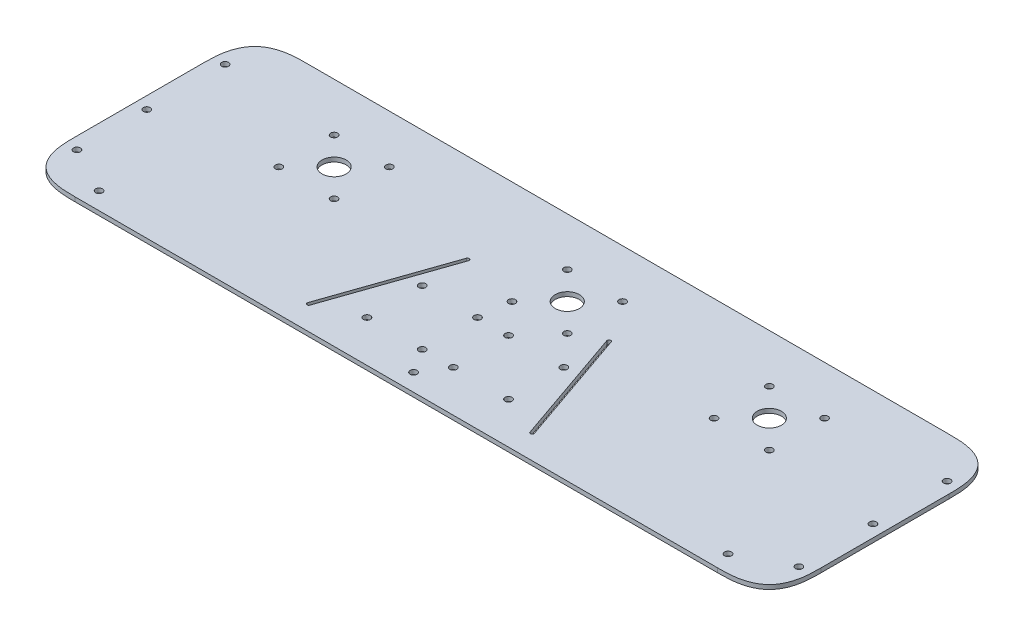
from build123d import *

# Parameters (mm, degrees)
SKETCH1_W           = 432
SKETCH1_H           = 200
BOSS_EXTRUDE1_DEPTH = 2.5
SKETCH3_R           = 7
SKETCH3_R_2         = 2
SKETCH3_W           = 498.20945101
SKETCH3_H           = 57.36356312
CUT_EXTRUDE1_DEPTH  = 2.5
SKETCH5_W           = 366.875294571
SKETCH5_H           = 10
SKETCH5_W_2         = 65.124705429
CUT_EXTRUDE3_DEPTH  = 2.5
SKETCH6_R           = 2
CUT_EXTRUDE4_DEPTH  = 2.5
CUT_EXTRUDE5_DEPTH  = 2.5
FILLET1_SIZE        = 30
SKETCH9_R           = 2
CUT_EXTRUDE6_DEPTH  = 2.5
SKETCH10_R          = 2
CUT_EXTRUDE7_DEPTH  = 2.5
SKETCH11_R          = 7
SKETCH11_R_2        = 2
CUT_EXTRUDE8_DEPTH  = 10


with BuildPart() as part:
    # Sketch1 → Boss-Extrude1 (new body)
    with BuildSketch(Plane(origin=(0, 0, 0), x_dir=(1, 0, 0), z_dir=(0, 1, 0))):
        with Locations((112.865968756, 71.914913526)):
            Rectangle(SKETCH1_W, SKETCH1_H)
    extrude(amount=BOSS_EXTRUDE1_DEPTH)

    # Sketch3 → Cut-Extrude1 (cut)
    with BuildSketch(Plane(origin=(0, 2.5, 0), x_dir=(1, 0, 0), z_dir=(0, 1, 0))):
        with Locations(Location((-13.134031244, 71.914913526, 0), (0, 0, 270))):
            Circle(SKETCH3_R)
        with Locations(Location((-29.135857702, 55.913087067, 0), (0, 0, 270))):
            Circle(SKETCH3_R_2)
        with Locations(Location((-29.135857702, 87.916739984, 0), (0, 0, 270))):
            Circle(SKETCH3_R_2)
        with Locations(Location((2.867795214, 55.913087067, 0), (0, 0, 270))):
            Circle(SKETCH3_R_2)
        with Locations(Location((2.867795214, 87.916739984, 0), (0, 0, 270))):
            Circle(SKETCH3_R_2)
        with Locations(Location((238.865968756, 71.914913526, 0), (0, 0, 270))):
            Circle(SKETCH3_R)
        with Locations((79.761243251, 144.596695086)):
            Rectangle(SKETCH3_W, SKETCH3_H)
        with Locations(Location((222.864142298, 55.913087067, 0), (0, 0, 270))):
            Circle(SKETCH3_R_2)
        with Locations(Location((254.867795214, 87.916739984, 0), (0, 0, 270))):
            Circle(SKETCH3_R_2)
        with Locations(Location((222.864142298, 87.916739984, 0), (0, 0, 270))):
            Circle(SKETCH3_R_2)
        with Locations(Location((254.867795214, 55.913087067, 0), (0, 0, 270))):
            Circle(SKETCH3_R_2)
    extrude(amount=-CUT_EXTRUDE1_DEPTH, mode=Mode.SUBTRACT)

    # Sketch5 → Cut-Extrude3 (cut)
    with BuildSketch(Plane(origin=(0, 2.5, 0), x_dir=(1, 0, 0), z_dir=(0, 1, 0))):
        with Locations((80.303616041, -23.085086474)):
            Rectangle(SKETCH5_W, SKETCH5_H)
        with Locations((296.303616042, -23.085086474)):
            Rectangle(SKETCH5_W_2, SKETCH5_H)
    extrude(amount=-CUT_EXTRUDE3_DEPTH, mode=Mode.SUBTRACT)

    # Sketch6 → Cut-Extrude4 (cut)
    with BuildSketch(Plane(origin=(0, 2.5, 0), x_dir=(1, 0, 0), z_dir=(0, 1, 0))):
        with Locations(Location((71.864142298, 5.913087067, 0), (0, 0, 270))):
            Circle(SKETCH6_R)
        with Locations(Location((71.864142298, 37.916739984, 0), (0, 0, 270))):
            Circle(SKETCH6_R)
        with Locations(Location((103.867795214, 37.916739984, 0), (0, 0, 270))):
            Circle(SKETCH6_R)
        with Locations(Location((103.867795214, 5.913087067, 0), (0, 0, 270))):
            Circle(SKETCH6_R)
        with Locations(Location((121.864142298, 5.913087067, 0), (0, 0, 270))):
            Circle(SKETCH6_R)
        with Locations(Location((121.864142298, 37.916739984, 0), (0, 0, 270))):
            Circle(SKETCH6_R)
        with Locations(Location((153.867795214, 37.916739984, 0), (0, 0, 270))):
            Circle(SKETCH6_R)
        with Locations(Location((153.867795214, 5.913087067, 0), (0, 0, 270))):
            Circle(SKETCH6_R)
    extrude(amount=-CUT_EXTRUDE4_DEPTH, mode=Mode.SUBTRACT)

    # Sketch8 → Cut-Extrude5 (cut)
    with BuildSketch(Plane(origin=(0, 2.5, 0), x_dir=(1, 0, 0), z_dir=(0, 1, 0))):
        with BuildLine():
            Line((176.582305496, -4.412929011), (152.923062834, 63.765083659))
            ThreePointArc((152.923062834, 63.765083659), (153.539952677, 65.037658577), (154.812527595, 64.420768733))
            Line((154.812527595, 64.420768733), (178.471770257, -3.757243937))
            ThreePointArc((178.471770257, -3.757243937), (177.854880414, -5.029818855), (176.582305496, -4.412929011))
        make_face()
        with BuildLine():
            Line((47.260167255, -3.757243937), (70.919409917, 64.420768733))
            ThreePointArc((70.919409917, 64.420768733), (72.191984835, 65.037658577), (72.808874679, 63.765083659))
            Line((72.808874679, 63.765083659), (49.149632016, -4.412929011))
            ThreePointArc((49.149632016, -4.412929011), (47.877057099, -5.029818855), (47.260167255, -3.757243937))
        make_face()
    extrude(amount=-CUT_EXTRUDE5_DEPTH, mode=Mode.SUBTRACT)

    # Fillet1
    # a fillet whose section is not a circle: 30 mm, written as the material it takes off along each edge
    with BuildSketch(Plane(origin=(-103.134031244, -75, -115.914913526), x_dir=(0, 0, 1), z_dir=(0, 1, 0)), Plane(origin=(-103.134031244, 77.5, 18.085086474), x_dir=(0, 0, -1), z_dir=(0, -1, 0)), Plane(origin=(328.865968756, 77.5, 18.085086474), x_dir=(-1, 0, 0), z_dir=(0, -1, 0))) as fillet1_piece_1:
        with BuildLine():
            add(Edge.make_bspline([(FILLET1_SIZE, 0), (FILLET1_SIZE * 0.831801948466, 0), (FILLET1_SIZE * 0.663603896932, 0), (FILLET1_SIZE * 0.292893218813, FILLET1_SIZE * 0.0716919198361), (FILLET1_SIZE * 0.0716919198361, FILLET1_SIZE * 0.292893218813), (0, FILLET1_SIZE * 0.663603896932), (0, FILLET1_SIZE * 0.831801948466), (0, FILLET1_SIZE)], knots=[0, 0, 0, 0, 0, 0, 0.5, 0.5, 1, 1, 1, 1, 1, 1], degree=5))
            Line((0, FILLET1_SIZE), (0, 0))
            Line((0, 0), (FILLET1_SIZE, 0))
        make_face()
    extrude(amount=152.5, mode=Mode.SUBTRACT)
    with BuildSketch(Plane(origin=(328.865968756, 77.5, -115.914913526), x_dir=(-1, 0, 0), z_dir=(0, -1, 0))) as fillet1_piece_2:
        with BuildLine():
            add(Edge.make_bspline([(FILLET1_SIZE, 0), (FILLET1_SIZE * 0.831801948466, 0), (FILLET1_SIZE * 0.663603896932, 0), (FILLET1_SIZE * 0.292893218813, -FILLET1_SIZE * 0.0716919198361), (FILLET1_SIZE * 0.0716919198361, -FILLET1_SIZE * 0.292893218813), (0, -FILLET1_SIZE * 0.663603896932), (0, -FILLET1_SIZE * 0.831801948466), (0, -FILLET1_SIZE)], knots=[0, 0, 0, 0, 0, 0, 0.5, 0.5, 1, 1, 1, 1, 1, 1], degree=5))
            Line((0, -FILLET1_SIZE), (0, 0))
            Line((0, 0), (FILLET1_SIZE, 0))
        make_face()
    extrude(amount=152.5, mode=Mode.SUBTRACT)

    # Sketch9 → Cut-Extrude6 (cut)
    with BuildSketch(Plane(origin=(0, 2.5, 0), x_dir=(1, 0, 0), z_dir=(0, 1, 0))):
        with Locations(Location((321.865968752, 6.010283068, 0), (0, 0, 270))):
            Circle(SKETCH9_R)
        with Locations(Location((321.865968752, 48.914945481, 0), (0, 0, 270))):
            Circle(SKETCH9_R)
        with Locations(Location((321.865968752, 91.819607898, 0), (0, 0, 270))):
            Circle(SKETCH9_R)
        with Locations(Location((-96.134031244, 46.467317494, 0), (0, 0, 270))):
            Circle(SKETCH9_R)
        with Locations(Location((-96.134031244, 91.819607898, 0), (0, 0, 270))):
            Circle(SKETCH9_R)
        with Locations(Location((-96.134031244, 6.010283068, 0), (0, 0, 270))):
            Circle(SKETCH9_R)
    extrude(amount=-CUT_EXTRUDE6_DEPTH, mode=Mode.SUBTRACT)

    # Sketch10 → Cut-Extrude7 (cut)
    with BuildSketch(Plane(origin=(0, 2.5, 0), x_dir=(1, 0, 0), z_dir=(0, 1, 0))):
        with Locations(Location((112.866022655, -8.085086472, 0), (0, 0, 270))):
            Circle(SKETCH10_R)
        with Locations(Location((294.941757967, -8.085086472, 0), (0, 0, 270))):
            Circle(SKETCH10_R)
        with Locations(Location((-69.209712656, -8.085086472, 0), (0, 0, 270))):
            Circle(SKETCH10_R)
    extrude(amount=-CUT_EXTRUDE7_DEPTH, mode=Mode.SUBTRACT)

    # Sketch11 → Cut-Extrude8 (cut)
    with BuildSketch(Plane(origin=(0, 2.5, 0), x_dir=(1, 0, 0), z_dir=(0, 1, 0))):
        with Locations(Location((121.864142298, 71.914913526, 0), (0, 0, 270))):
            Circle(SKETCH11_R)
        with Locations(Location((105.86231584, 55.913087067, 0), (0, 0, 270))):
            Circle(SKETCH11_R_2)
        with Locations(Location((137.865968756, 87.916739984, 0), (0, 0, 270))):
            Circle(SKETCH11_R_2)
        with Locations(Location((137.865968756, 55.913087067, 0), (0, 0, 270))):
            Circle(SKETCH11_R_2)
        with Locations(Location((105.86231584, 87.916739984, 0), (0, 0, 270))):
            Circle(SKETCH11_R_2)
    extrude(amount=-CUT_EXTRUDE8_DEPTH, mode=Mode.SUBTRACT)


solid = part.part
